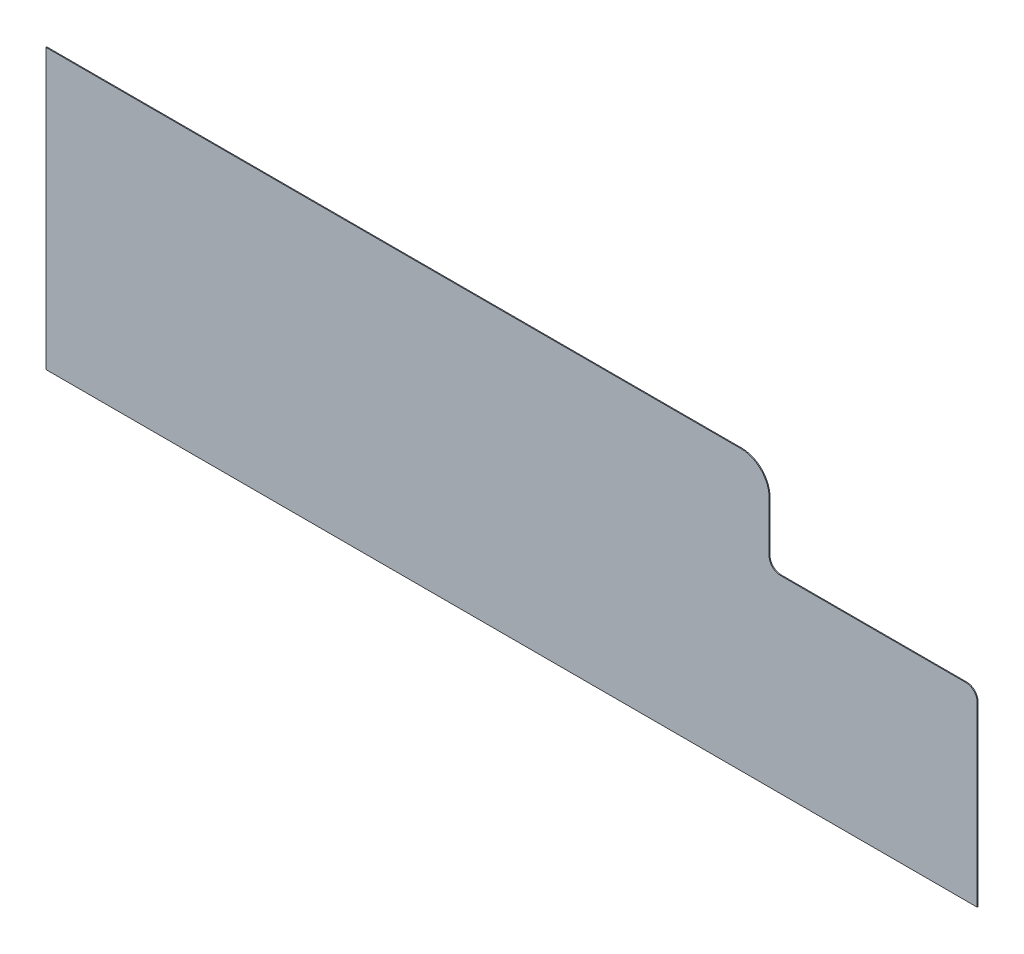
from build123d import *

# Parameters (mm, degrees)
BRIDA_BASE1_DEPTH = 1.5875
REDONDEO2_R       = 20
REDONDEO3_R       = 50
REDONDEO4_R       = 20


# Sheet-metal steps are written as plain solids
with BuildPart() as part:
    # Croquis1 → Brida base1 (new body)
    with BuildSketch(Plane.XY):
        Polygon((-1104.973795497, 203.132185629), (178.706204503, 203.132185629), (178.706204503, 43.132185629), (547.966204503, 43.132185629), (547.966204503, -292.267814371), (-1104.973795497, -292.267814371), align=None)
    extrude(amount=-BRIDA_BASE1_DEPTH)

    # Redondeo2
    redondeo2_edges = [part.edges().sort_by_distance(p)[0] for p in [
        (178.706204503, 43.132185629, -0.79375),
    ]]
    fillet(redondeo2_edges, radius=REDONDEO2_R)

    # Redondeo3
    redondeo3_edges = [part.edges().sort_by_distance(p)[0] for p in [
        (178.706204503, 203.132185629, -0.79375),
    ]]
    fillet(redondeo3_edges, radius=REDONDEO3_R)

    # Redondeo4
    redondeo4_edges = [part.edges().sort_by_distance(p)[0] for p in [
        (547.966204503, 43.132185629, -0.79375),
    ]]
    fillet(redondeo4_edges, radius=REDONDEO4_R)


solid = part.part
